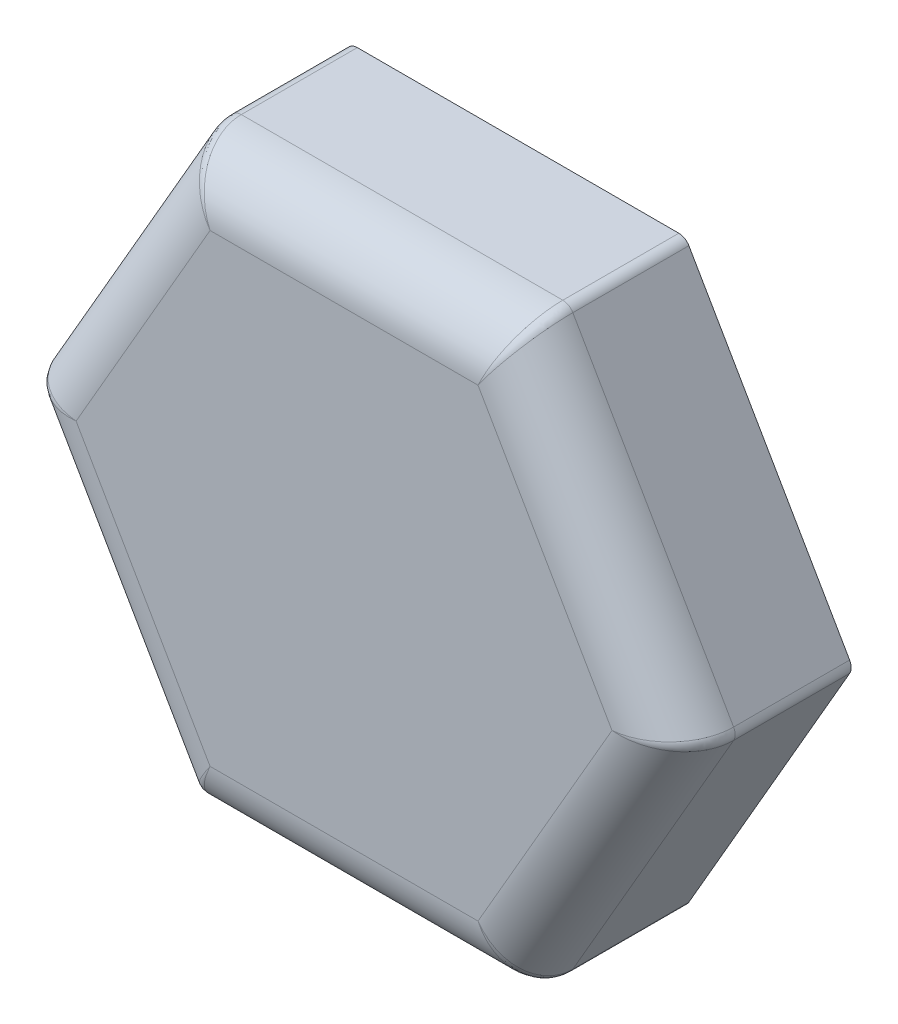
from build123d import *

# Parameters (mm, degrees)
DODANIE_WYCI_GNI_CIE1_DEPTH = 15
ZAOKR_GLENIE1_R             = 5
ZAOKR_GLENIE2_R             = 1
SZKIC3_R                    = 11
DODANIE_WYCI_GNI_CIE2_DEPTH = 6


with BuildPart() as part:
    # Szkic1 → Dodanie-wyciągnięcie1 (new body)
    with BuildSketch(Plane.XY):
        Polygon((14.43375673, -25), (28.867513459, 0), (14.43375673, 25), (-14.43375673, 25), (-28.867513459, 0), (-14.43375673, -25), align=None)
    extrude(amount=DODANIE_WYCI_GNI_CIE1_DEPTH)

    # Zaokrąglenie1
    zaokr_glenie1_edges = [part.edges().sort_by_distance(p)[0] for p in [
        (0, 25, 15),
        (-21.650635095, 12.5, 15),
        (-21.650635095, -12.5, 15),
        (0, -25, 15),
        (21.650635095, -12.5, 15),
        (21.650635095, 12.5, 15),
    ]]
    fillet(zaokr_glenie1_edges, radius=ZAOKR_GLENIE1_R)

    # Zaokrąglenie2
    zaokr_glenie2_edges = [part.edges().sort_by_distance(p)[0] for p in [
        (-13.514121691, 23.407145389, 13.65942076),
        (-27.02824329, 0, 13.659420835),
        (-13.514121691, -23.407145389, 13.65942076),
        (13.514121691, -23.407145389, 13.65942076),
        (27.028243383, 0, 13.65942076),
        (13.514121691, 23.407145389, 13.65942076),
        (-14.43375673, 25, 5),
        (-28.867513459, 0, 5),
        (-14.43375673, -25, 5),
        (14.43375673, -25, 5),
        (28.867513459, 0, 5),
        (14.43375673, 25, 5),
    ]]
    fillet(zaokr_glenie2_edges, radius=ZAOKR_GLENIE2_R)

    # Szkic3 → Dodanie-wyciągnięcie2 (add)
    with BuildSketch(Plane(origin=(0, 0, 0), x_dir=(-1, 0, 0), z_dir=(0, 0, -1))):
        Circle(SZKIC3_R)
        Polygon((4.618802154, -8), (9.237604307, 0), (4.618802154, 8), (-4.618802154, 8), (-9.237604307, 0), (-4.618802154, -8), align=None, mode=Mode.SUBTRACT)
    extrude(amount=DODANIE_WYCI_GNI_CIE2_DEPTH)


solid = part.part
